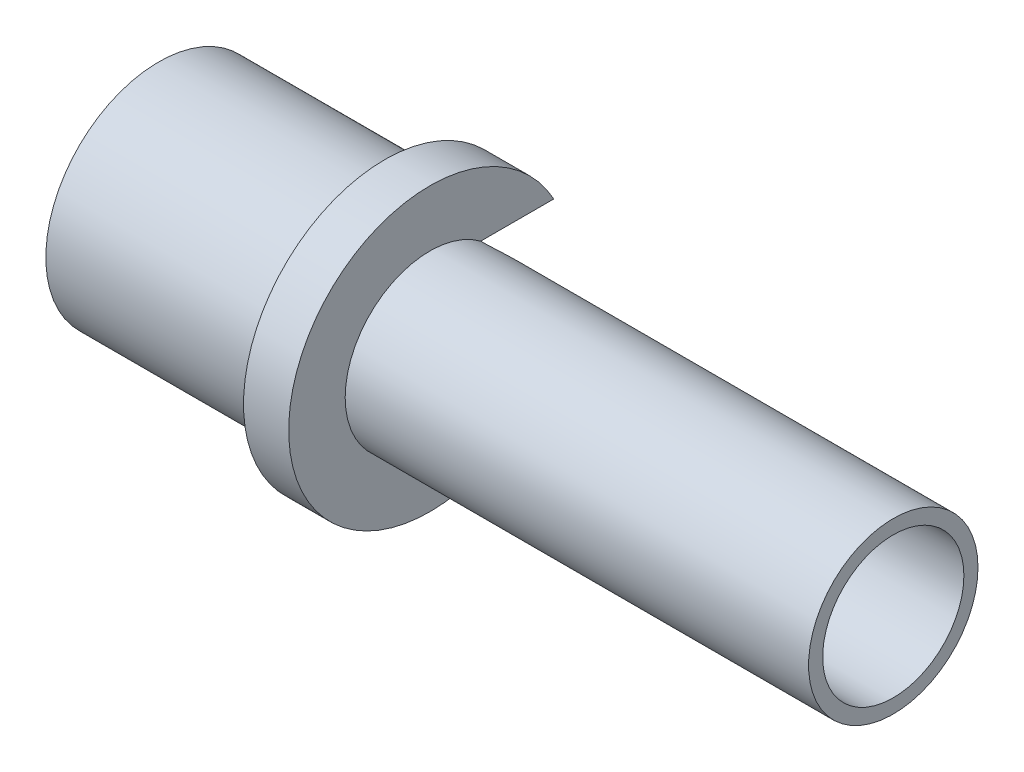
from build123d import *

# Parameters (mm, degrees)
CUT_EXTRUDE2_REACH = 41.719


with BuildPart() as part:
    # Sketch1 → Revolve1 (revolve)
    with BuildSketch(Plane.XY):
        Polygon((3.19, 3.96875), (3.19, 4.7625), (-22.86, 4.7625), (-22.86, 7.9375), (-25.4, 7.9375), (-25.4, 6.35), (-38.1, 6.35), (-38.1, 3.96875), align=None)
    revolve(axis=Axis((0, 0, 0), (-1, 0, 0)))

    # Sketch3 → Cut-Extrude2 (cut, up to next)
    with BuildSketch(Plane.XY, mode=Mode.PRIVATE) as cut_extrude2_sk1:
        with BuildLine():
            Line((-38.1, 3.81), (-38.1, -3.81))
            Line((-38.1, -3.81), (-22.86, -3.81))
            ThreePointArc((-22.86, -3.81), (-20.61493597, -2.88006403), (-19.685, -0.635))
            Line((-19.685, -0.635), (-19.685, 0.635))
            ThreePointArc((-19.685, 0.635), (-20.61493597, 2.88006403), (-22.86, 3.81))
            Line((-22.86, 3.81), (-38.1, 3.81))
        make_face()
    cut_extrude2_tool1 = extrude(cut_extrude2_sk1.sketch, amount=-CUT_EXTRUDE2_REACH, mode=Mode.PRIVATE) & part.part
    add(cut_extrude2_tool1.solids().sort_by_distance((-29.16287, 0, 0))[0], mode=Mode.SUBTRACT)


solid = part.part
